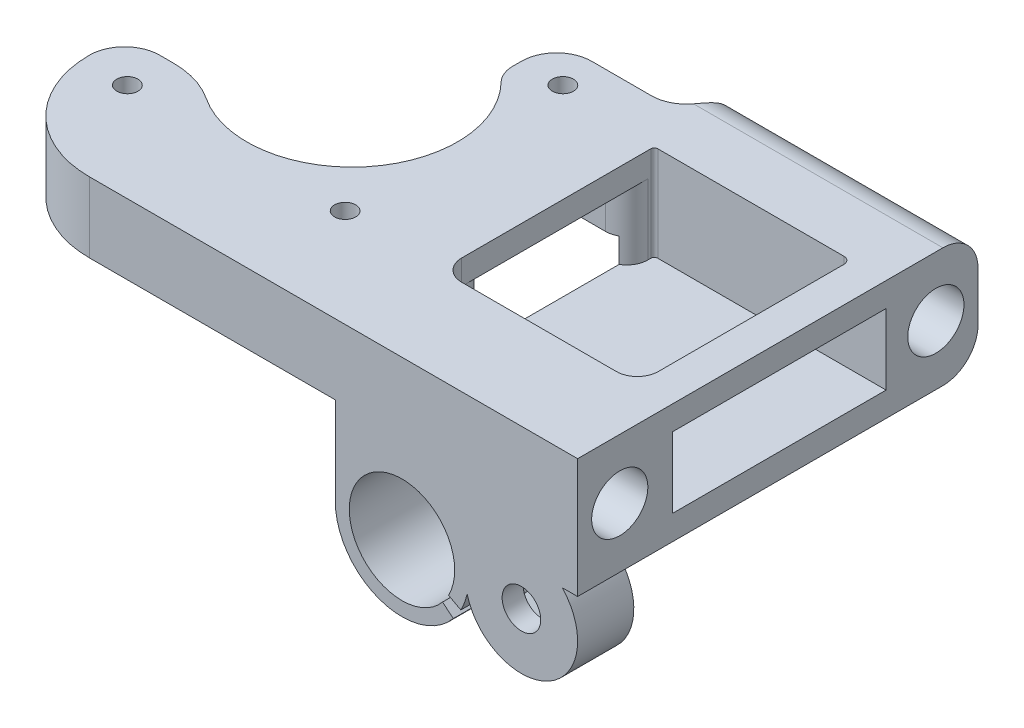
from build123d import *

# Parameters (mm, degrees)
EXTRUDE1_DEPTH               = 57
SKETCH2_R                    = 2.75
EXTRUDE2_DEPTH               = 8
EXTRUDE3_DEPTH               = 5
EXTRUDE4_DEPTH               = 50
SKETCH5_R                    = 4
EXTRUDE5_DEPTH               = 33
SKETCH6_W                    = 30
SKETCH6_H                    = 10
EXTRUDE6_DEPTH               = 33
SKETCH7_W                    = 50
SKETCH7_H                    = 10
EXTRUDE7_DEPTH               = 50
SKETCH10_R                   = 1.5
EXTRUDE10_DEPTH              = 10
SKETCH11_R                   = 2.75
EXTRUDE13_DEPTH              = 1
SKETCH12_R                   = 15
EXTRUDE14_DEPTH              = 10
FILLET2_R                    = 5
FILLET3_R                    = 5
FILLET4_R                    = 10
EXTRUDE15_REACH              = 96.553
SKETCH14_W                   = 20
SKETCH14_H                   = 10
EXTRUDE16_DEPTH              = 60
EXTRUDE18_DEPTH              = 60
FILLET5_R                    = 10
FILLET7_R                    = 3
FILLET8_R                    = 5
FILLET9_R                    = 5
SKETCH16_R                   = 11.304866209
EXTRUDE19_DEPTH              = 6.5
FILLET11_R                   = 12
FILLET12_R                   = 10
FILLET13_R                   = 4
FILLET14_R                   = 5
FILLET15_R                   = 5
EXTRUDE21_DEPTH              = 10
SCHIZZO1_W                   = 30.415697361
SCHIZZO1_H                   = 13.5
TAGLIO_ESTRUSIONE1_DEPTH     = 33
RACCORDO1_R                  = 3
RACCORDO2_R                  = 0.5
SCHIZZO2_W                   = 30.415697361
SCHIZZO2_H                   = 3.443824092
ESTRUSIONE_ESTRUSIONE1_DEPTH = 5
RACCORDO3_R                  = 1
RACCORDO4_R                  = 3
SCHIZZO3_W                   = 12.709856415
SCHIZZO3_H                   = 30.470472699
ESTRUSIONE_ESTRUSIONE2_DEPTH = 3.5


# Some blends are built 0.0001 mm under size
with BuildPart() as part:
    # Sketch1 → Extrude1 (new body)
    with BuildSketch(Plane.XY):
        with BuildLine():
            Line((73.499997202, -17), (73.499997202, 0))
            Line((73.499997202, 0), (39, 0))
            Line((39, 0), (39, -17))
            Line((39, -17), (43.389340395, -17))
            ThreePointArc((43.389340395, -17), (48.49587093, -14.994566191), (53.602401465, -17))
            Line((53.602401465, -17), (73.499997202, -17))
        make_face()
    extrude(amount=-EXTRUDE1_DEPTH)

    # Sketch2 → Extrude2 (add)
    with BuildSketch(Plane.XY):
        with BuildLine():
            Line((57.95839, -23.293955), (57.95839, -17))
            Line((57.95839, -17), (71.309471167, -17))
            ThreePointArc((71.309471167, -17), (69.395977388, -29.48722516), (57.767354943, -24.550891432))
            ThreePointArc((57.767354943, -24.550891432), (57.883931975, -23.925623937), (57.95839, -23.293955))
        make_face()
        with Locations((65.5, -22.5)):
            Circle(SKETCH2_R, mode=Mode.SUBTRACT)
    extrude(amount=-EXTRUDE2_DEPTH)

    # Sketch3 → Extrude3 (cut)
    with BuildSketch(Plane(origin=(0, 0, -8), x_dir=(-1, 0, 0), z_dir=(0, 0, -1))):
        Polygon((-69.5, -20.190598923), (-65.5, -17.881197846), (-61.5, -20.190598923), (-61.5, -24.809401077), (-65.5, -27.118802154), (-69.5, -24.809401077), align=None)
    extrude(amount=-EXTRUDE3_DEPTH, mode=Mode.SUBTRACT)

    # Sketch4 → Extrude4 (add)
    with BuildSketch(Plane.XY):
        with BuildLine():
            Line((39, -17), (39, -22.5))
            ThreePointArc((39, -22.5), (45.271742795, -31.43055539), (55.801591252, -28.564919557))
            Line((55.801591252, -28.564919557), (54.269524764, -27.292339419))
            ThreePointArc((54.269524764, -27.292339419), (43.338902241, -27.950290613), (43.389340395, -17))
            Line((43.389340395, -17), (39, -17))
        make_face()
        with BuildLine():
            Line((56.876362299, -26.964085637), (55.118731957, -26.027376827))
            ThreePointArc((55.118731957, -26.027376827), (55.896414133, -21.25571178), (53.602401465, -17))
            Line((53.602401465, -17), (57.95839, -17))
            Line((57.95839, -17), (57.95839, -23.293955))
            ThreePointArc((57.95839, -23.293955), (57.60414849, -25.184084529), (56.876362299, -26.964085637))
        make_face()
    extrude(amount=-EXTRUDE4_DEPTH)

    # Sketch5 → Extrude5 (cut)
    with BuildSketch(Plane(origin=(73.499997202, 0, 0), x_dir=(0, 0, -1), z_dir=(1, 0, 0))):
        with Locations((6, -8.5)):
            Circle(SKETCH5_R)
        with Locations((51, -8.5)):
            Circle(SKETCH5_R)
    extrude(amount=-EXTRUDE5_DEPTH, mode=Mode.SUBTRACT)

    # Sketch6 → Extrude6 (cut)
    with BuildSketch(Plane(origin=(73.499997202, 0, 0), x_dir=(0, 0, -1), z_dir=(1, 0, 0))):
        with Locations((28.5, -8.5)):
            Rectangle(SKETCH6_W, SKETCH6_H)
    extrude(amount=-EXTRUDE6_DEPTH, mode=Mode.SUBTRACT)

    # Sketch7 → Extrude7 (add)
    with BuildSketch(Plane.ZY.offset(-39)):
        with Locations((-25, -5)):
            Rectangle(SKETCH7_W, SKETCH7_H)
    extrude(amount=EXTRUDE7_DEPTH)

    # Sketch10 → Extrude10 (cut)
    with BuildSketch(Plane.XZ.offset(10)):
        with Locations((-4.599204374, -45)):
            Circle(SKETCH10_R)
        with Locations((26.400795626, -45)):
            Circle(SKETCH10_R)
        with Locations((26.400795626, -14)):
            Circle(SKETCH10_R)
        with Locations((-4.599204374, -14)):
            Circle(SKETCH10_R)
    extrude(amount=-EXTRUDE10_DEPTH, mode=Mode.SUBTRACT)

    # Sketch11 → Extrude13 (cut)
    with BuildSketch(Plane.XZ.offset(10)):
        with Locations((-4.599204374, -14)):
            Circle(SKETCH11_R)
        with Locations((26.400795626, -14)):
            Circle(SKETCH11_R)
        with Locations((26.400795626, -45)):
            Circle(SKETCH11_R)
    extrude(amount=-EXTRUDE13_DEPTH, mode=Mode.SUBTRACT)

    # Sketch12 → Extrude14 (cut)
    with BuildSketch(Plane.XZ.offset(10)):
        with Locations((10.900795626, -30.5)):
            Circle(SKETCH12_R)
    extrude(amount=-EXTRUDE14_DEPTH, mode=Mode.SUBTRACT)

    # Fillet2
    fillet2_edges = [part.edges().sort_by_distance(p)[0] for p in [
        (48.49587093, -14.994566191, -57),
        (63.551199334, -17, -57),
        (41.194670197, -17, -57),
    ]]
    fillet(fillet2_edges, radius=FILLET2_R)

    # Fillet3
    fillet3_edges = [part.edges().sort_by_distance(p)[0] for p in [
        (56.249998601, 0, -57),
    ]]
    fillet(fillet3_edges, radius=FILLET3_R)

    # Fillet4
    fillet4_edges = [part.edges().sort_by_distance(p)[0] for p in [
        (56.999997202, -13.5, -43.5),
    ]]
    fillet(fillet4_edges, radius=FILLET4_R - 0.0001)  # a hair under: the kernel refuses the full size

    # Extrude15: up to this face of the body (flat: up to its plane)
    extrude15_end = Plane(part.part.faces().sort_by_distance((35.938109504, 0, -24.375937497))[0])
    # Sketch13 → Extrude15 (cut, up to the picked face)
    with BuildSketch(Plane.XZ.offset(17), mode=Mode.PRIVATE) as extrude15_sk1:
        with BuildLine():
            Line((57.95839, -16.137451745), (57.95839, -43.862548255))
            ThreePointArc((57.95839, -43.862548255), (69.999997202, -30), (57.95839, -16.137451745))
        make_face()
    extrude15_tool1 = split(extrude(extrude15_sk1.sketch, amount=-EXTRUDE15_REACH, mode=Mode.PRIVATE), bisect_by=extrude15_end, keep=Keep.BOTH, mode=Mode.PRIVATE)
    add(extrude15_tool1.solids().sort_by(Axis((63.013259, -17, -30), (0, 1, 0)))[0], mode=Mode.SUBTRACT)

    # Sketch14 → Extrude16 (cut)
    with BuildSketch(Plane(origin=(40.499997202, 0, 0), x_dir=(0, 0, -1), z_dir=(1, 0, 0))):
        with Locations((30, -8.5)):
            Rectangle(SKETCH14_W, SKETCH14_H)
    extrude(amount=-EXTRUDE16_DEPTH, mode=Mode.SUBTRACT)

    # Sketch15 → Extrude18 (cut)
    with BuildSketch(Plane(origin=(0, 0, 0), x_dir=(1, 0, 0), z_dir=(0, 1, 0))):
        Polygon((2.11392048, 20), (-12.43887347, 20), (-12.43887347, 50), (20.496397049, 50), (20.496397049, 40), (2.11392048, 40), align=None)
    extrude(amount=-EXTRUDE18_DEPTH, mode=Mode.SUBTRACT)

    # Fillet5
    # the kernel refuses this fillet: 10 mm, written as the material it adds along each edge
    with BuildSketch(Plane(origin=(73.499997202, -13.5, -13.5), x_dir=(0, 1, 0), z_dir=(-1, 0, 0))) as fillet5_piece_1_section:
        with BuildLine():
            CenterArc((FILLET5_R, FILLET5_R), FILLET5_R, 180, 90)
            Line((0, FILLET5_R), (0, 0))
            Line((0, 0), (FILLET5_R, 0))
        make_face()
    fillet5_piece_1 = extrude(amount=33, mode=Mode.PRIVATE)
    fillet5_piece_1 = split(fillet5_piece_1, bisect_by=Plane(origin=(57.95839, -13.5, -13.5), z_dir=(1, 0, 0)), keep=Keep.TOP, mode=Mode.PRIVATE)
    fillet5_piece_1 = fillet5_piece_1 - Plane(origin=(55.999766898, -13.5, -30), x_dir=(0.13989934874108464, 0, -0.9901657296744927), z_dir=(0, -1, 0)) * Cylinder(14.000230304, 106, mode=Mode.PRIVATE)
    add(fillet5_piece_1)
    with BuildSketch(Plane(origin=(73.499997202, -13.5, -13.5), x_dir=(0, 1, 0), z_dir=(-1, 0, 0))) as fillet5_piece_2_section:
        with BuildLine():
            CenterArc((FILLET5_R, FILLET5_R), FILLET5_R, 180, 90)
            Line((0, FILLET5_R), (0, 0))
            Line((0, 0), (FILLET5_R, 0))
        make_face()
    fillet5_piece_2 = extrude(amount=33, mode=Mode.PRIVATE)
    fillet5_piece_2 = split(fillet5_piece_2, bisect_by=Plane(origin=(57.95839, -13.5, -13.5), z_dir=(-1, 0, 0)), keep=Keep.TOP, mode=Mode.PRIVATE)
    fillet5_piece_2 = fillet5_piece_2 - Plane(origin=(55.999766898, -13.5, -30), x_dir=(0.13989934874108464, 0, -0.9901657296744927), z_dir=(0, -1, 0)) * Cylinder(14.000230304, 106, mode=Mode.PRIVATE)
    add(fillet5_piece_2)
    with BuildSketch(Plane(origin=(73.499997202, -13.5, -13.5), x_dir=(0, 1, 0), z_dir=(-1, 0, 0))) as fillet5_piece_3_section:
        with BuildLine():
            CenterArc((FILLET5_R, FILLET5_R), FILLET5_R, 180, 90)
            Line((0, FILLET5_R), (0, 0))
            Line((0, 0), (FILLET5_R, 0))
        make_face()
    fillet5_piece_3 = extrude(amount=33, mode=Mode.PRIVATE)
    fillet5_piece_3 = split(fillet5_piece_3, bisect_by=Plane(origin=(57.95839, -13.5, -13.5), z_dir=(-1, 0, 0)), keep=Keep.TOP, mode=Mode.PRIVATE)
    fillet5_piece_3 = fillet5_piece_3 & Plane(origin=(55.999766898, -13.5, -30), x_dir=(0.13989934874108464, 0, -0.9901657296744927), z_dir=(0, -1, 0)) * Cylinder(14.000230304, 106, mode=Mode.PRIVATE)
    add(fillet5_piece_3)
    with BuildSketch(Plane(origin=(73.499997202, -13.5, -13.5), x_dir=(0, 1, 0), z_dir=(-1, 0, 0))) as fillet5_piece_4_section:
        with BuildLine():
            CenterArc((FILLET5_R, FILLET5_R), FILLET5_R, 180, 90)
            Line((0, FILLET5_R), (0, 0))
            Line((0, 0), (FILLET5_R, 0))
        make_face()
    fillet5_piece_4 = extrude(amount=58, mode=Mode.PRIVATE)
    fillet5_piece_4 = split(fillet5_piece_4, bisect_by=Plane(origin=(40.499997202, -13.5, -13.5), z_dir=(-1, 0, 0)), keep=Keep.TOP, mode=Mode.PRIVATE)
    fillet5_piece_4 = split(fillet5_piece_4, bisect_by=Plane(origin=(39, -13.5, -13.5), z_dir=(1, 0, 0)), keep=Keep.TOP, mode=Mode.PRIVATE)
    add(fillet5_piece_4)

    # Fillet7
    # the kernel refuses this fillet: 3 mm, written as the material it takes off along each edge
    with BuildSketch(Plane(origin=(40.499997202, -18.59939602, -40), x_dir=(0, 0, -1), z_dir=(0, 1, 0))) as fillet7_piece_1_section:
        with BuildLine():
            CenterArc((FILLET7_R, FILLET7_R), FILLET7_R, 180, 90)
            Line((0, FILLET7_R), (0, 0))
            Line((0, 0), (FILLET7_R, 0))
        make_face()
    fillet7_piece_1 = extrude(amount=15.09939602, mode=Mode.PRIVATE)
    fillet7_piece_1 = split(fillet7_piece_1, bisect_by=Plane(origin=(40.499997202, -13.5, -40), z_dir=(0, 1, 0)), keep=Keep.TOP, mode=Mode.PRIVATE)
    add(fillet7_piece_1, mode=Mode.SUBTRACT)
    with BuildSketch(Plane(origin=(40.499997202, -3.5, -20), x_dir=(0, 0, 1), z_dir=(0, -1, 0))) as fillet7_piece_2_section:
        with BuildLine():
            CenterArc((FILLET7_R, FILLET7_R), FILLET7_R, 180, 90)
            Line((0, FILLET7_R), (0, 0))
            Line((0, 0), (FILLET7_R, 0))
        make_face()
    fillet7_piece_2 = extrude(amount=16.867496998, mode=Mode.PRIVATE)
    fillet7_piece_2 = fillet7_piece_2 & Plane(origin=(40.499997202, -3.5, -23.5), x_dir=(0, 1, 0), z_dir=(1, 0, 0)) * Cylinder(10, 46, mode=Mode.PRIVATE)
    add(fillet7_piece_2, mode=Mode.SUBTRACT)

    # Fillet8
    fillet8_edges = [part.edges().sort_by_distance(p)[0] for p in [
        (-11, -5, -20),
    ]]
    fillet(fillet8_edges, radius=FILLET8_R)

    # Fillet9
    fillet9_edges = [part.edges().sort_by_distance(p)[0] for p in [
        (20.496397049, -5, -50),
    ]]
    fillet(fillet9_edges, radius=FILLET9_R)

    # Sketch16 → Extrude19 (cut)
    with BuildSketch(Plane.XZ.offset(10)):
        with Locations((10.900795626, -23)):
            Circle(SKETCH16_R)
    extrude(amount=-EXTRUDE19_DEPTH, mode=Mode.SUBTRACT)

    # Fillet11
    fillet11_edges = [part.edges().sort_by_distance(p)[0] for p in [
        (0.188652983, -1.75, -20),
    ]]
    fillet(fillet11_edges, radius=FILLET11_R)

    # Fillet12
    # the kernel refuses this fillet: 10 mm, written as the material it takes off along each edge
    with BuildSketch(Plane(origin=(0.248932323, -25.691286784, -19.213470169), x_dir=(-0.9921172382235202, 0, -0.12531315022668255), z_dir=(0, 1, 0))) as fillet12_piece_1:
        with BuildLine():
            CenterArc((5.023383211, 9.921172382), FILLET12_R, 224.802027264, 52.396812902)
            Line((-2.072074833, 2.874579224), (-2.781620637, 2.169919908))
            ThreePointArc((-2.781620637, 2.169919908), (-1.733922523, 0.934235059), (-0.892836327, -0.450381276))
            Line((-0.892836327, -0.450381276), (-0.236172529, -0.971711138))
            ThreePointArc((-0.236172529, -0.971711138), (4.463141301, -1.236990436), (6.401827864, -0.992117238))
            Line((6.401827864, -0.992117238), (6.276514713, 0))
        make_face()
    extrude(amount=22.191286784, mode=Mode.SUBTRACT)
    with BuildSketch(Plane(origin=(21.800336901, -3.5, -20), x_dir=(-0.44613745720692305, 0, 0.8949644514040438), z_dir=(0, -1, 0))) as fillet12_piece_2:
        with BuildLine():
            CenterArc((6.282027837, -9.812689637), FILLET12_R, 101.107051159, 52.396812902)
            Line((-2.667616677, -5.351315065), (0, 0))
            ThreePointArc((0, 0), (2.177800275, -0.21175186), (4.35560055, 0))
        make_face()
    extrude(amount=21.44840118, mode=Mode.SUBTRACT)

    # Fillet13
    fillet13_edges = [part.edges().sort_by_distance(p)[0] for p in [
        (20.496397049, -5, -42.029285899),
    ]]
    fillet(fillet13_edges, radius=FILLET13_R)

    # Fillet14
    # the kernel refuses this fillet: 5 mm, written as the material it takes off along each edge
    with BuildSketch(Plane(origin=(22.508982392, -3.5, -40), x_dir=(-0.66658148626187, 0, -0.7454321714099255), z_dir=(0, -1, 0))) as fillet14_piece_1:
        with BuildLine():
            CenterArc((2.329986209, 4.895355464), FILLET14_R, 221.803767382, 36.4534432)
            Line((-1.397174648, 1.562448032), (-1.471717865, 1.495789884))
            Line((-1.471717865, 1.495789884), (-0.074543217, -0.066658149))
            Line((-0.074543217, -0.066658149), (0.004374645, -0.099904267))
            ThreePointArc((0.004374645, -0.099904267), (0.656196759, -0.085639987), (1.292041664, -0.097907109))
            Line((1.292041664, -0.097907109), (1.312393518, 0))
        make_face()
    extrude(amount=11.740074457, mode=Mode.SUBTRACT)

    # Fillet15
    fillet15_edges = [part.edges().sort_by_distance(p)[0] for p in [
        (39, -5, -50),
    ]]
    fillet(fillet15_edges, radius=FILLET15_R)

    # Sketch17 → Extrude21 (cut)
    with BuildSketch(Plane.XZ.offset(10)):
        with BuildLine():
            Line((4, 0), (4, 2.372948922))
            Line((4, 2.372948922), (-13.409134184, 2.372948922))
            Line((-13.409134184, 2.372948922), (-13.409134184, -15))
            Line((-13.409134184, -15), (-11, -15))
            ThreePointArc((-11, -15), (-6.606601718, -4.393398282), (4, 0))
        make_face()
    extrude(amount=-EXTRUDE21_DEPTH, mode=Mode.SUBTRACT)

    # Schizzo1 → Taglio-Estrusione1 (cut)
    with BuildSketch(Plane(origin=(73.499997202, 0, 0), x_dir=(0, 0, -1), z_dir=(1, 0, 0))):
        with Locations((28.70784868, -6.75)):
            Rectangle(SCHIZZO1_W, SCHIZZO1_H)
    extrude(amount=-TAGLIO_ESTRUSIONE1_DEPTH, mode=Mode.SUBTRACT)

    # Raccordo1
    raccordo1_edges = [part.edges().sort_by_distance(p)[0] for p in [
        (40.499997202, -6.75, -13.5),
    ]]
    fillet(raccordo1_edges, radius=RACCORDO1_R)

    # Raccordo2
    raccordo2_edges = [part.edges().sort_by_distance(p)[0] for p in [
        (40.499997202, -6.75, -43.915697361),
    ]]
    fillet(raccordo2_edges, radius=RACCORDO2_R)

    # Schizzo2 → Estrusione-Estrusione1 (add)
    with BuildSketch(Plane(origin=(73.499997202, 0, 0), x_dir=(0, 0, -1), z_dir=(1, 0, 0))):
        with Locations((28.70784868, -1.721912046)):
            Rectangle(SCHIZZO2_W, SCHIZZO2_H)
    extrude(amount=-ESTRUSIONE_ESTRUSIONE1_DEPTH)

    # Raccordo3
    raccordo3_edges = [part.edges().sort_by_distance(p)[0] for p in [
        (68.499997202, -1.721912046, -43.915697361),
    ]]
    fillet(raccordo3_edges, radius=RACCORDO3_R)

    # Raccordo4
    raccordo4_edges = [part.edges().sort_by_distance(p)[0] for p in [
        (68.499997202, -1.721912046, -13.5),
    ]]
    fillet(raccordo4_edges, radius=RACCORDO4_R)

    # Schizzo3 → Estrusione-Estrusione2 (add)
    with BuildSketch(Plane.XZ.offset(17)):
        with Locations((64.313318208, -29.162710378)):
            Rectangle(SCHIZZO3_W, SCHIZZO3_H)
    extrude(amount=-ESTRUSIONE_ESTRUSIONE2_DEPTH)


solid = part.part
